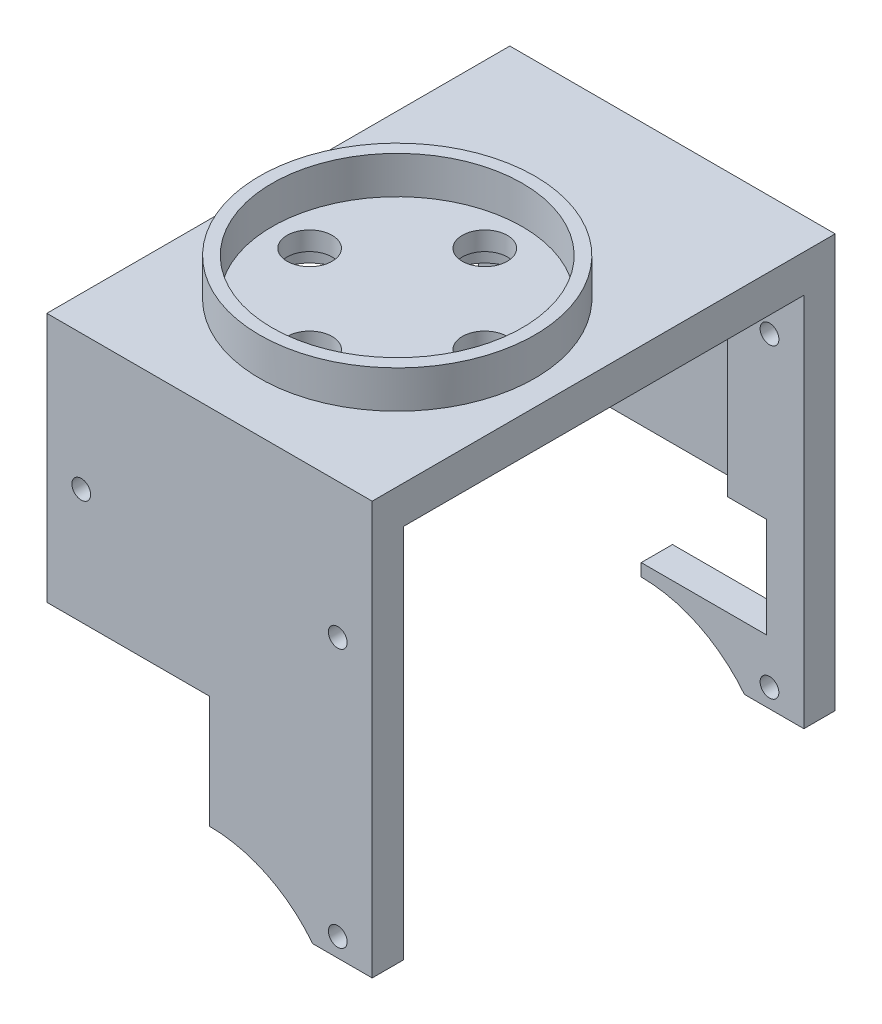
from build123d import *

# Parameters (mm, degrees)
SKETCH_1_W                      = 26
SKETCH_1_H                      = 33
EXTRUDE_1_DEPTH                 = 37
SKETCH_3_W                      = 26
SKETCH_3_H                      = 32
CUT_EXTRUDE_1_DEPTH             = 30
CUT_EXTRUDE_2_REACH             = 57.982
SKETCH_2_R                      = 0.75
CUT_EXTRUDE_2_DIRECTION_2_DEPTH = 56.982140009
CUT_EXTRUDE_3_REACH             = 57.982
SKETCH_4_R                      = 0.75
SKETCH_5_W                      = 17
SKETCH_5_H                      = 1.5
CUT_EXTRUDE_4_DEPTH             = 27
CUT_EXTRUDE_5_REACH             = 57.982
SKETCH_6_W                      = 20
SKETCH_6_H                      = 8
CUT_EXTRUDE_START               = -37
CUT_EXTRUDE_6_OUTLINE_R         = 0.75
CUT_EXTRUDE_6_DEPTH             = 37
SKETCH_8_W                      = 15
SKETCH_8_H                      = 1.5
CUT_EXTRUDE_7_DEPTH             = 13
SKETCH_9_R                      = 11
SKETCH_9_R_2                    = 10
EXTRUDE_2_DEPTH                 = 3
CUT_EXTRUDE_8_REACH             = 57.982
SKETCH_10_R                     = 1.8
SKETCH_11_R                     = 2.8
CUT_EXTRUDE_9_DEPTH             = 1.5


# Read off the part's stored shape, not the designer's step: 切除-拉伸6
with BuildPart() as part:
    # 草图1 → 凸台-拉伸1 (new body)
    with BuildSketch(Plane.XY):
        with Locations((13, 16.5)):
            Rectangle(SKETCH_1_W, SKETCH_1_H)
    extrude(amount=EXTRUDE_1_DEPTH)

    # 草图3 → 切除-拉伸1 (cut)
    with BuildSketch(Plane.XZ):
        with Locations((13, 18.5)):
            Rectangle(SKETCH_3_W, SKETCH_3_H)
    extrude(amount=-CUT_EXTRUDE_1_DEPTH, mode=Mode.SUBTRACT)

    # 草图2 → 切除-拉伸2 (cut, up to next)
    with BuildSketch(Plane.XY.offset(37), mode=Mode.PRIVATE) as cut_extrude_2_sk1:
        with Locations(Location((2.75, 1.5, 0), (0, 0, 180))):
            Circle(SKETCH_2_R)
    cut_extrude_2_tool1 = extrude(cut_extrude_2_sk1.sketch, amount=-CUT_EXTRUDE_2_REACH, mode=Mode.PRIVATE) & part.part
    # 草图2 → 切除-拉伸2 (cut, up to next)
    with BuildSketch(Plane.XY.offset(37), mode=Mode.PRIVATE) as cut_extrude_2_sk2:
        with Locations(Location((23.25, 1.5, 0), (0, 0, 180))):
            Circle(SKETCH_2_R)
    cut_extrude_2_tool2 = extrude(cut_extrude_2_sk2.sketch, amount=-CUT_EXTRUDE_2_REACH, mode=Mode.PRIVATE) & part.part
    # 草图2 → 切除-拉伸2 (cut, up to next)
    with BuildSketch(Plane.XY.offset(37), mode=Mode.PRIVATE) as cut_extrude_2_sk3:
        with Locations(Location((23.25, 22.2, 0), (0, 0, 180))):
            Circle(SKETCH_2_R)
    cut_extrude_2_tool3 = extrude(cut_extrude_2_sk3.sketch, amount=-CUT_EXTRUDE_2_REACH, mode=Mode.PRIVATE) & part.part
    # 草图2 → 切除-拉伸2 (cut, up to next)
    with BuildSketch(Plane.XY.offset(37), mode=Mode.PRIVATE) as cut_extrude_2_sk4:
        with Locations(Location((2.75, 22.2, 0), (0, 0, 180))):
            Circle(SKETCH_2_R)
    cut_extrude_2_tool4 = extrude(cut_extrude_2_sk4.sketch, amount=-CUT_EXTRUDE_2_REACH, mode=Mode.PRIVATE) & part.part
    add(cut_extrude_2_tool1.solids().sort_by_distance((2.75, 1.5, 37))[0], mode=Mode.SUBTRACT)
    add(cut_extrude_2_tool2.solids().sort_by_distance((23.25, 1.5, 37))[0], mode=Mode.SUBTRACT)
    add(cut_extrude_2_tool3.solids().sort_by_distance((23.25, 22.2, 37))[0], mode=Mode.SUBTRACT)
    add(cut_extrude_2_tool4.solids().sort_by_distance((2.75, 22.2, 37))[0], mode=Mode.SUBTRACT)

    # 草图2 → 切除-拉伸2 direction 2 (cut)
    with BuildSketch(Plane.XY.offset(37)):
        with Locations(Location((2.75, 1.5, 0), (0, 0, 180))):
            Circle(SKETCH_2_R)
        with Locations(Location((23.25, 1.5, 0), (0, 0, 180))):
            Circle(SKETCH_2_R)
        with Locations(Location((23.25, 22.2, 0), (0, 0, 180))):
            Circle(SKETCH_2_R)
        with Locations(Location((2.75, 22.2, 0), (0, 0, 180))):
            Circle(SKETCH_2_R)
    extrude(amount=CUT_EXTRUDE_2_DIRECTION_2_DEPTH, mode=Mode.SUBTRACT)

    # 草图4 → 切除-拉伸3 (cut, up to next)
    with BuildSketch(Plane(origin=(0, 0, 0), x_dir=(-1, 0, 0), z_dir=(0, 0, -1)), mode=Mode.PRIVATE) as cut_extrude_3_sk1:
        with Locations((-2.75, 1.5)):
            Circle(SKETCH_4_R)
    cut_extrude_3_tool1 = extrude(cut_extrude_3_sk1.sketch, amount=-CUT_EXTRUDE_3_REACH, mode=Mode.PRIVATE) & part.part
    # 草图4 → 切除-拉伸3 (cut, up to next)
    with BuildSketch(Plane(origin=(0, 0, 0), x_dir=(-1, 0, 0), z_dir=(0, 0, -1)), mode=Mode.PRIVATE) as cut_extrude_3_sk2:
        with Locations((-23.25, 1.5)):
            Circle(SKETCH_4_R)
    cut_extrude_3_tool2 = extrude(cut_extrude_3_sk2.sketch, amount=-CUT_EXTRUDE_3_REACH, mode=Mode.PRIVATE) & part.part
    # 草图4 → 切除-拉伸3 (cut, up to next)
    with BuildSketch(Plane(origin=(0, 0, 0), x_dir=(-1, 0, 0), z_dir=(0, 0, -1)), mode=Mode.PRIVATE) as cut_extrude_3_sk3:
        with Locations((-23.25, 25.95)):
            Circle(SKETCH_4_R)
    cut_extrude_3_tool3 = extrude(cut_extrude_3_sk3.sketch, amount=-CUT_EXTRUDE_3_REACH, mode=Mode.PRIVATE) & part.part
    # 草图4 → 切除-拉伸3 (cut, up to next)
    with BuildSketch(Plane(origin=(0, 0, 0), x_dir=(-1, 0, 0), z_dir=(0, 0, -1)), mode=Mode.PRIVATE) as cut_extrude_3_sk4:
        with Locations((-3.25, 25.95)):
            Circle(SKETCH_4_R)
    cut_extrude_3_tool4 = extrude(cut_extrude_3_sk4.sketch, amount=-CUT_EXTRUDE_3_REACH, mode=Mode.PRIVATE) & part.part
    add(cut_extrude_3_tool1.solids().sort_by_distance((2.75, 1.5, 0))[0], mode=Mode.SUBTRACT)
    add(cut_extrude_3_tool2.solids().sort_by_distance((23.25, 1.5, 0))[0], mode=Mode.SUBTRACT)
    add(cut_extrude_3_tool3.solids().sort_by_distance((23.25, 25.95, 0))[0], mode=Mode.SUBTRACT)
    add(cut_extrude_3_tool4.solids().sort_by_distance((3.25, 25.95, 0))[0], mode=Mode.SUBTRACT)

    # 草图5 → 切除-拉伸4 (cut)
    with BuildSketch(Plane.XZ):
        with Locations((13, 35.25)):
            Rectangle(SKETCH_5_W, SKETCH_5_H)
    extrude(amount=-CUT_EXTRUDE_4_DEPTH, mode=Mode.SUBTRACT)

    # 草图6 → 切除-拉伸5 (cut, up to next)
    with BuildSketch(Plane(origin=(0, 0, 0), x_dir=(-1, 0, 0), z_dir=(0, 0, -1)), mode=Mode.PRIVATE) as cut_extrude_5_sk1:
        with Locations((-13, 9)):
            Rectangle(SKETCH_6_W, SKETCH_6_H)
    cut_extrude_5_tool1 = extrude(cut_extrude_5_sk1.sketch, amount=-CUT_EXTRUDE_5_REACH, mode=Mode.PRIVATE) & part.part
    add(cut_extrude_5_tool1.solids().sort_by_distance((13, 9, 0))[0], mode=Mode.SUBTRACT)

    # 切除-拉伸6 outline → 切除-拉伸6 (cut)
    with BuildSketch(Plane(origin=(0, 0, 0), x_dir=(-1, 0, 0), z_dir=(0, 0, -1)).offset(CUT_EXTRUDE_START)):
        with BuildLine():
            Line((0, 0), (0, 13))
            Line((0, 13), (-13, 13))
            Line((-13, 13), (-13, 4))
            ThreePointArc((-13, 4), (-17.582575695, 2.947221814), (-21.246211251, 0))
            Line((-21.246211251, 0), (0, 0))
        make_face()
        with Locations((-2.75, 1.5)):
            Circle(CUT_EXTRUDE_6_OUTLINE_R, mode=Mode.SUBTRACT)
    extrude(amount=CUT_EXTRUDE_6_DEPTH, mode=Mode.SUBTRACT)

    # 草图8 → 切除-拉伸7 (cut)
    with BuildSketch(Plane.XZ.offset(-13)):
        with Locations((12.397702636, 1.75)):
            Rectangle(SKETCH_8_W, SKETCH_8_H)
    extrude(amount=-CUT_EXTRUDE_7_DEPTH, mode=Mode.SUBTRACT)

    # 草图9 → 凸台-拉伸2 (add)
    with BuildSketch(Plane(origin=(0, 33, 0), x_dir=(1, 0, 0), z_dir=(0, 1, 0))):
        with Locations(Location((13, -22, 0), (0, 0, 90))):
            Circle(SKETCH_9_R)
        with Locations(Location((13, -22, 0), (0, 0, 270))):
            Circle(SKETCH_9_R_2, mode=Mode.SUBTRACT)
    extrude(amount=EXTRUDE_2_DEPTH)

    # 草图10 → 切除-拉伸8 (cut, up to next)
    with BuildSketch(Plane(origin=(0, 33, 0), x_dir=(1, 0, 0), z_dir=(0, 1, 0)), mode=Mode.PRIVATE) as cut_extrude_8_sk1:
        with Locations(Location((13, -15, 0), (0, 0, 270))):
            Circle(SKETCH_10_R)
    cut_extrude_8_tool1 = extrude(cut_extrude_8_sk1.sketch, amount=-CUT_EXTRUDE_8_REACH, mode=Mode.PRIVATE) & part.part
    # 草图10 → 切除-拉伸8 (cut, up to next)
    with BuildSketch(Plane(origin=(0, 33, 0), x_dir=(1, 0, 0), z_dir=(0, 1, 0)), mode=Mode.PRIVATE) as cut_extrude_8_sk2:
        with Locations(Location((20, -22, 0), (0, 0, 270))):
            Circle(SKETCH_10_R)
    cut_extrude_8_tool2 = extrude(cut_extrude_8_sk2.sketch, amount=-CUT_EXTRUDE_8_REACH, mode=Mode.PRIVATE) & part.part
    # 草图10 → 切除-拉伸8 (cut, up to next)
    with BuildSketch(Plane(origin=(0, 33, 0), x_dir=(1, 0, 0), z_dir=(0, 1, 0)), mode=Mode.PRIVATE) as cut_extrude_8_sk3:
        with Locations(Location((13, -29, 0), (0, 0, 270))):
            Circle(SKETCH_10_R)
    cut_extrude_8_tool3 = extrude(cut_extrude_8_sk3.sketch, amount=-CUT_EXTRUDE_8_REACH, mode=Mode.PRIVATE) & part.part
    # 草图10 → 切除-拉伸8 (cut, up to next)
    with BuildSketch(Plane(origin=(0, 33, 0), x_dir=(1, 0, 0), z_dir=(0, 1, 0)), mode=Mode.PRIVATE) as cut_extrude_8_sk4:
        with Locations(Location((6, -22, 0), (0, 0, 270))):
            Circle(SKETCH_10_R)
    cut_extrude_8_tool4 = extrude(cut_extrude_8_sk4.sketch, amount=-CUT_EXTRUDE_8_REACH, mode=Mode.PRIVATE) & part.part
    add(cut_extrude_8_tool1.solids().sort_by_distance((13, 33, 15))[0], mode=Mode.SUBTRACT)
    add(cut_extrude_8_tool2.solids().sort_by_distance((20, 33, 22))[0], mode=Mode.SUBTRACT)
    add(cut_extrude_8_tool3.solids().sort_by_distance((13, 33, 29))[0], mode=Mode.SUBTRACT)
    add(cut_extrude_8_tool4.solids().sort_by_distance((6, 33, 22))[0], mode=Mode.SUBTRACT)

    # 草图11 → 切除-拉伸9 (cut)
    with BuildSketch(Plane.XZ.offset(-30)):
        with Locations(Location((6, 22, 0), (0, 0, 270))):
            Circle(SKETCH_11_R)
        with Locations(Location((13, 29, 0), (0, 0, 270))):
            Circle(SKETCH_11_R)
        with Locations(Location((20, 22, 0), (0, 0, 270))):
            Circle(SKETCH_11_R)
        with Locations(Location((13, 15, 0), (0, 0, 270))):
            Circle(SKETCH_11_R)
    extrude(amount=-CUT_EXTRUDE_9_DEPTH, mode=Mode.SUBTRACT)


solid = part.part
